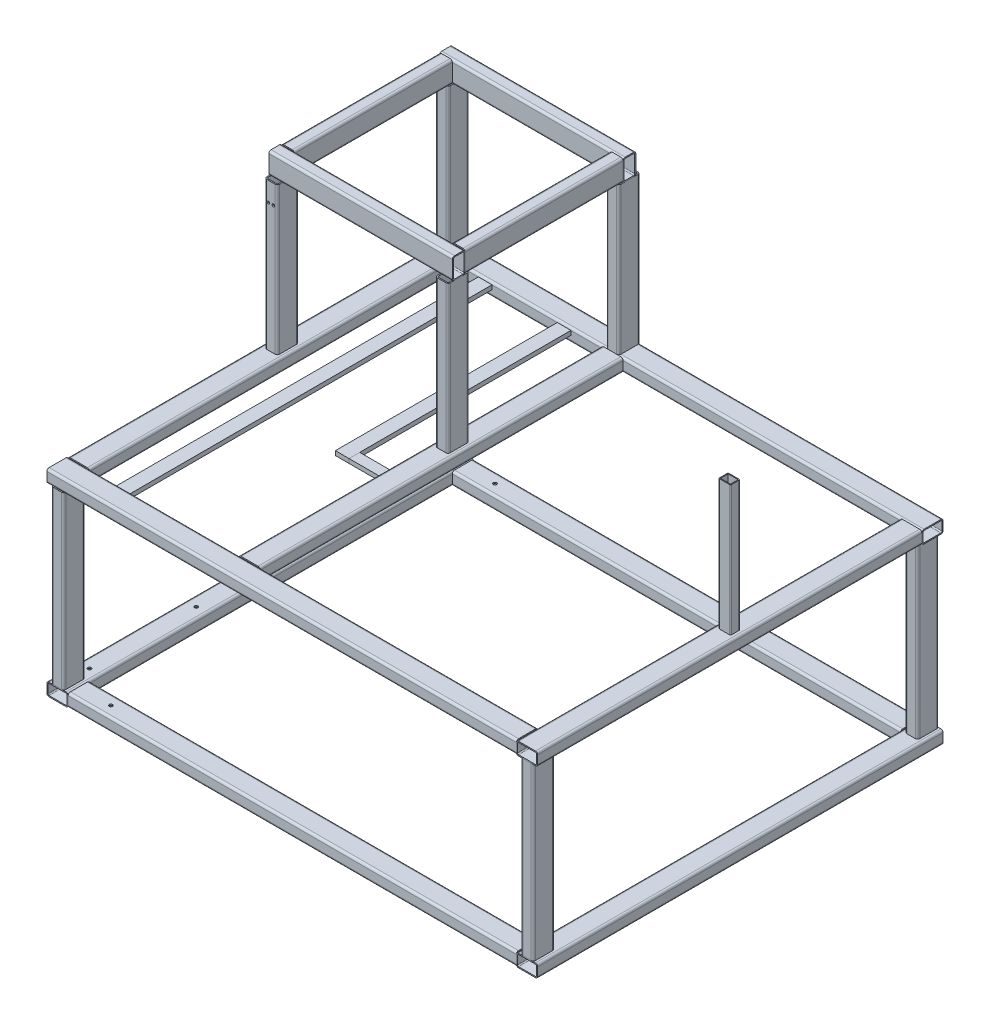
from build123d import *

# Parameters (mm, degrees)
RECTANGULAR_START                         = 15
RECTANGULAR_TUBE_50_X_30_X_2_6_1_DEPTH    = 400
RECTANGULAR_START_2                       = -925
RECTANGULAR_TUBE_50_X_30_X_2_6_1_2_DEPTH  = 950
RECTANGULAR_START_3                       = 25
RECTANGULAR_TUBE_50_X_30_X_2_6_1_3_DEPTH  = 1050
RECTANGULAR_TUBE_50_X_30_X_2_6_1_4_DEPTH  = 400
RECTANGULAR_TUBE_50_X_30_X_2_6_1_5_DEPTH  = 1050
RECTANGULAR_TUBE_50_X_30_X_2_6_1_6_DEPTH  = 400
RECTANGULAR_TUBE_50_X_30_X_2_6_1_7_DEPTH  = 950
RECTANGULAR_TUBE_50_X_30_X_2_6_1_8_DEPTH  = 400
RECTANGULAR_START_4                       = -875
RECTANGULAR_TUBE_50_X_30_X_2_6_1_9_DEPTH  = 900
RECTANGULAR_TUBE_50_X_30_X_2_6_1_10_DEPTH = 1100
RECTANGULAR_START_5                       = -25
RECTANGULAR_TUBE_50_X_30_X_2_6_1_11_DEPTH = 1100
RECTANGULAR_TUBE_50_X_30_X_2_6_1_12_DEPTH = 900
RECTANGULAR_TUBE_50_X_30_X_2_6_1_13_DEPTH = 850
SKETCH3_R                                 = 4
CUT_EXTRUDE2_DEPTH                        = 64
SKETCH4_R                                 = 4
CUT_EXTRUDE3_DEPTH                        = 64
RECTANGULAR_START_6                       = 445
RECTANGULAR_TUBE_50_X_30_X_2_6_24_DEPTH   = 345
RECTANGULAR_START_7                       = -15
RECTANGULAR_TUBE_50_X_30_X_2_6_24_2_DEPTH = 430
RECTANGULAR_START_8                       = -885
RECTANGULAR_TUBE_50_X_30_X_2_6_24_3_DEPTH = 370
RECTANGULAR_TUBE_50_X_30_X_2_6_24_4_DEPTH = 345
RECTANGULAR_TUBE_50_X_30_X_2_6_24_5_DEPTH = 370
RECTANGULAR_TUBE_50_X_30_X_2_6_24_6_DEPTH = 345
RECTANGULAR_TUBE_50_X_30_X_2_6_24_7_DEPTH = 430
RECTANGULAR_TUBE_50_X_30_X_2_6_24_8_DEPTH = 345
SKETCH16_W                                = 32
SKETCH16_H                                = 10
BOSS_EXTRUDE2_DEPTH                       = 850
SKETCH17_W                                = 32
SKETCH17_H                                = 10
BOSS_EXTRUDE3_DEPTH                       = 520
SKETCH18_W                                = 25
SKETCH18_H                                = 10
BOSS_EXTRUDE4_DEPTH                       = 72
SKETCH20_R                                = 3
CUT_EXTRUDE4_DEPTH                        = 10
SKETCH21_W                                = 27.6
SKETCH21_H                                = 22
SKETCH21_W_2                              = 23.6
SKETCH21_H_2                              = 18
BOSS_EXTRUDE5_DEPTH                       = 305
FILLET1_R                                 = 2


with BuildPart() as part:
    # Rectangular tube 50 X 30 X 2.6(1): read off the stored shape, not the designer's step
    # Rectangular tube 50 X 30 X 2.6(1) outline → Rectangular tube 50 X 30 X 2.6(1) (new body)
    with BuildSketch(Plane(origin=(0, 0, 0), x_dir=(1, 0, 0), z_dir=(0, 1, 0)).offset(RECTANGULAR_START)):
        with BuildLine():
            Line((1115, 880.2), (1115, 919.8))
            ThreePointArc((1115, 919.8), (1113.476955262, 923.476955262), (1109.8, 925))
            Line((1109.8, 925), (1090.2, 925))
            ThreePointArc((1090.2, 925), (1086.523044738, 923.476955262), (1085, 919.8))
            Line((1085, 919.8), (1085, 880.2))
            ThreePointArc((1085, 880.2), (1086.523044738, 876.523044738), (1090.2, 875))
            Line((1090.2, 875), (1109.8, 875))
            ThreePointArc((1109.8, 875), (1113.476955262, 876.523044738), (1115, 880.2))
        make_face()
        with BuildLine():
            ThreePointArc((1090.2, 877.6), (1088.361522369, 878.361522369), (1087.6, 880.2))
            Line((1087.6, 880.2), (1087.6, 919.8))
            ThreePointArc((1087.6, 919.8), (1088.361522369, 921.638477631), (1090.2, 922.4))
            Line((1090.2, 922.4), (1109.8, 922.4))
            ThreePointArc((1109.8, 922.4), (1111.638477631, 921.638477631), (1112.4, 919.8))
            Line((1112.4, 919.8), (1112.4, 880.2))
            ThreePointArc((1112.4, 880.2), (1111.638477631, 878.361522369), (1109.8, 877.6))
            Line((1109.8, 877.6), (1090.2, 877.6))
        make_face(mode=Mode.SUBTRACT)
    extrude(amount=RECTANGULAR_TUBE_50_X_30_X_2_6_1_DEPTH)


with BuildPart() as body_2:
    # Rectangular tube 50 X 30 X 2.6_1 2 outli → Rectangular tube 50 X 30 X 2.6_1 2 (new body)
    with BuildSketch(Plane.XY.offset(RECTANGULAR_START_2)):
        with BuildLine():
            ThreePointArc((1080.2, 15), (1076.523044738, 13.476955262), (1075, 9.8))
            Line((1075, 9.8), (1075, -9.8))
            ThreePointArc((1075, -9.8), (1076.523044738, -13.476955262), (1080.2, -15))
            Line((1080.2, -15), (1119.8, -15))
            ThreePointArc((1119.8, -15), (1123.476955262, -13.476955262), (1125, -9.8))
            Line((1125, -9.8), (1125, 9.8))
            ThreePointArc((1125, 9.8), (1123.476955262, 13.476955262), (1119.8, 15))
            Line((1119.8, 15), (1080.2, 15))
        make_face()
        with BuildLine():
            Line((1119.8, -12.4), (1080.2, -12.4))
            ThreePointArc((1080.2, -12.4), (1078.361522369, -11.638477631), (1077.6, -9.8))
            Line((1077.6, -9.8), (1077.6, 9.8))
            ThreePointArc((1077.6, 9.8), (1078.361522369, 11.638477631), (1080.2, 12.4))
            Line((1080.2, 12.4), (1119.8, 12.4))
            ThreePointArc((1119.8, 12.4), (1121.638477631, 11.638477631), (1122.4, 9.8))
            Line((1122.4, 9.8), (1122.4, -9.8))
            ThreePointArc((1122.4, -9.8), (1121.638477631, -11.638477631), (1119.8, -12.4))
        make_face(mode=Mode.SUBTRACT)
    extrude(amount=RECTANGULAR_TUBE_50_X_30_X_2_6_1_2_DEPTH)


with BuildPart() as body_3:
    # Rectangular tube 50 X 30 X 2.6_1 3 outli → Rectangular tube 50 X 30 X 2.6_1 3 (new body)
    with BuildSketch(Plane.YZ.offset(RECTANGULAR_START_3)):
        with BuildLine():
            ThreePointArc((15, -880.2), (13.476955262, -876.523044738), (9.8, -875))
            Line((9.8, -875), (-9.8, -875))
            ThreePointArc((-9.8, -875), (-13.476955262, -876.523044738), (-15, -880.2))
            Line((-15, -880.2), (-15, -919.8))
            ThreePointArc((-15, -919.8), (-13.476955262, -923.476955262), (-9.8, -925))
            Line((-9.8, -925), (9.8, -925))
            ThreePointArc((9.8, -925), (13.476955262, -923.476955262), (15, -919.8))
            Line((15, -919.8), (15, -880.2))
        make_face()
        with BuildLine():
            Line((-12.4, -919.8), (-12.4, -880.2))
            ThreePointArc((-12.4, -880.2), (-11.638477631, -878.361522369), (-9.8, -877.6))
            Line((-9.8, -877.6), (9.8, -877.6))
            ThreePointArc((9.8, -877.6), (11.638477631, -878.361522369), (12.4, -880.2))
            Line((12.4, -880.2), (12.4, -919.8))
            ThreePointArc((12.4, -919.8), (11.638477631, -921.638477631), (9.8, -922.4))
            Line((9.8, -922.4), (-9.8, -922.4))
            ThreePointArc((-9.8, -922.4), (-11.638477631, -921.638477631), (-12.4, -919.8))
        make_face(mode=Mode.SUBTRACT)
    extrude(amount=RECTANGULAR_TUBE_50_X_30_X_2_6_1_3_DEPTH)


with BuildPart() as body_4:
    # Rectangular tube 50 X 30 X 2.6_1 4 outli → Rectangular tube 50 X 30 X 2.6_1 4 (new body)
    with BuildSketch(Plane(origin=(0, 0, 0), x_dir=(1, 0, 0), z_dir=(0, 1, 0)).offset(RECTANGULAR_START)):
        with BuildLine():
            Line((1115, -19.8), (1115, 19.8))
            ThreePointArc((1115, 19.8), (1113.476955262, 23.476955262), (1109.8, 25))
            Line((1109.8, 25), (1090.2, 25))
            ThreePointArc((1090.2, 25), (1086.523044738, 23.476955262), (1085, 19.8))
            Line((1085, 19.8), (1085, -19.8))
            ThreePointArc((1085, -19.8), (1086.523044738, -23.476955262), (1090.2, -25))
            Line((1090.2, -25), (1109.8, -25))
            ThreePointArc((1109.8, -25), (1113.476955262, -23.476955262), (1115, -19.8))
        make_face()
        with BuildLine():
            ThreePointArc((1090.2, -22.4), (1088.361522369, -21.638477631), (1087.6, -19.8))
            Line((1087.6, -19.8), (1087.6, 19.8))
            ThreePointArc((1087.6, 19.8), (1088.361522369, 21.638477631), (1090.2, 22.4))
            Line((1090.2, 22.4), (1109.8, 22.4))
            ThreePointArc((1109.8, 22.4), (1111.638477631, 21.638477631), (1112.4, 19.8))
            Line((1112.4, 19.8), (1112.4, -19.8))
            ThreePointArc((1112.4, -19.8), (1111.638477631, -21.638477631), (1109.8, -22.4))
            Line((1109.8, -22.4), (1090.2, -22.4))
        make_face(mode=Mode.SUBTRACT)
    extrude(amount=RECTANGULAR_TUBE_50_X_30_X_2_6_1_4_DEPTH)


with BuildPart() as body_5:
    # Rectangular tube 50 X 30 X 2.6_1 5 outli → Rectangular tube 50 X 30 X 2.6_1 5 (new body)
    with BuildSketch(Plane.YZ.offset(RECTANGULAR_START_3)):
        with BuildLine():
            Line((-9.8, -25), (9.8, -25))
            ThreePointArc((9.8, -25), (13.476955262, -23.476955262), (15, -19.8))
            Line((15, -19.8), (15, 19.8))
            ThreePointArc((15, 19.8), (13.476955262, 23.476955262), (9.8, 25))
            Line((9.8, 25), (-9.8, 25))
            ThreePointArc((-9.8, 25), (-13.476955262, 23.476955262), (-15, 19.8))
            Line((-15, 19.8), (-15, -19.8))
            ThreePointArc((-15, -19.8), (-13.476955262, -23.476955262), (-9.8, -25))
        make_face()
        with BuildLine():
            ThreePointArc((-9.8, -22.4), (-11.638477631, -21.638477631), (-12.4, -19.8))
            Line((-12.4, -19.8), (-12.4, 19.8))
            ThreePointArc((-12.4, 19.8), (-11.638477631, 21.638477631), (-9.8, 22.4))
            Line((-9.8, 22.4), (9.8, 22.4))
            ThreePointArc((9.8, 22.4), (11.638477631, 21.638477631), (12.4, 19.8))
            Line((12.4, 19.8), (12.4, -19.8))
            ThreePointArc((12.4, -19.8), (11.638477631, -21.638477631), (9.8, -22.4))
            Line((9.8, -22.4), (-9.8, -22.4))
        make_face(mode=Mode.SUBTRACT)
    extrude(amount=RECTANGULAR_TUBE_50_X_30_X_2_6_1_5_DEPTH)


with BuildPart() as body_6:
    # Rectangular tube 50 X 30 X 2.6_1 6 outli → Rectangular tube 50 X 30 X 2.6_1 6 (new body)
    with BuildSketch(Plane(origin=(0, 0, 0), x_dir=(1, 0, 0), z_dir=(0, 1, 0)).offset(RECTANGULAR_START)):
        with BuildLine():
            Line((15, -19.8), (15, 19.8))
            ThreePointArc((15, 19.8), (13.476955262, 23.476955262), (9.8, 25))
            Line((9.8, 25), (-9.8, 25))
            ThreePointArc((-9.8, 25), (-13.476955262, 23.476955262), (-15, 19.8))
            Line((-15, 19.8), (-15, -19.8))
            ThreePointArc((-15, -19.8), (-13.476955262, -23.476955262), (-9.8, -25))
            Line((-9.8, -25), (9.8, -25))
            ThreePointArc((9.8, -25), (13.476955262, -23.476955262), (15, -19.8))
        make_face()
        with BuildLine():
            ThreePointArc((-9.8, -22.4), (-11.638477631, -21.638477631), (-12.4, -19.8))
            Line((-12.4, -19.8), (-12.4, 19.8))
            ThreePointArc((-12.4, 19.8), (-11.638477631, 21.638477631), (-9.8, 22.4))
            Line((-9.8, 22.4), (9.8, 22.4))
            ThreePointArc((9.8, 22.4), (11.638477631, 21.638477631), (12.4, 19.8))
            Line((12.4, 19.8), (12.4, -19.8))
            ThreePointArc((12.4, -19.8), (11.638477631, -21.638477631), (9.8, -22.4))
            Line((9.8, -22.4), (-9.8, -22.4))
        make_face(mode=Mode.SUBTRACT)
    extrude(amount=RECTANGULAR_TUBE_50_X_30_X_2_6_1_6_DEPTH)


with BuildPart() as body_7:
    # Rectangular tube 50 X 30 X 2.6_1 7 outli → Rectangular tube 50 X 30 X 2.6_1 7 (new body)
    with BuildSketch(Plane.XY.offset(RECTANGULAR_START_2)):
        with BuildLine():
            Line((25, -9.8), (25, 9.8))
            ThreePointArc((25, 9.8), (23.476955262, 13.476955262), (19.8, 15))
            Line((19.8, 15), (-19.8, 15))
            ThreePointArc((-19.8, 15), (-23.476955262, 13.476955262), (-25, 9.8))
            Line((-25, 9.8), (-25, -9.8))
            ThreePointArc((-25, -9.8), (-23.476955262, -13.476955262), (-19.8, -15))
            Line((-19.8, -15), (19.8, -15))
            ThreePointArc((19.8, -15), (23.476955262, -13.476955262), (25, -9.8))
        make_face()
        with BuildLine():
            ThreePointArc((22.4, -9.8), (21.638477631, -11.638477631), (19.8, -12.4))
            Line((19.8, -12.4), (-19.8, -12.4))
            ThreePointArc((-19.8, -12.4), (-21.638477631, -11.638477631), (-22.4, -9.8))
            Line((-22.4, -9.8), (-22.4, 9.8))
            ThreePointArc((-22.4, 9.8), (-21.638477631, 11.638477631), (-19.8, 12.4))
            Line((-19.8, 12.4), (19.8, 12.4))
            ThreePointArc((19.8, 12.4), (21.638477631, 11.638477631), (22.4, 9.8))
            Line((22.4, 9.8), (22.4, -9.8))
        make_face(mode=Mode.SUBTRACT)
    extrude(amount=RECTANGULAR_TUBE_50_X_30_X_2_6_1_7_DEPTH)

    # Sketch3 → Cut-Extrude2 (cut)
    with BuildSketch(Plane.XZ.offset(15)):
        with Locations((0, -50)):
            Circle(SKETCH3_R)
        with Locations((0, -850)):
            Circle(SKETCH3_R)
        with Locations((0, -300)):
            Circle(SKETCH3_R)
        with Locations((0, -600)):
            Circle(SKETCH3_R)
    extrude(amount=-CUT_EXTRUDE2_DEPTH, mode=Mode.SUBTRACT)


with BuildPart() as body_8:
    # Rectangular tube 50 X 30 X 2.6_1 8 outli → Rectangular tube 50 X 30 X 2.6_1 8 (new body)
    with BuildSketch(Plane(origin=(0, 0, 0), x_dir=(1, 0, 0), z_dir=(0, 1, 0)).offset(RECTANGULAR_START)):
        with BuildLine():
            Line((15, 880.2), (15, 919.8))
            ThreePointArc((15, 919.8), (13.476955262, 923.476955262), (9.8, 925))
            Line((9.8, 925), (-9.8, 925))
            ThreePointArc((-9.8, 925), (-13.476955262, 923.476955262), (-15, 919.8))
            Line((-15, 919.8), (-15, 880.2))
            ThreePointArc((-15, 880.2), (-13.476955262, 876.523044738), (-9.8, 875))
            Line((-9.8, 875), (9.8, 875))
            ThreePointArc((9.8, 875), (13.476955262, 876.523044738), (15, 880.2))
        make_face()
        with BuildLine():
            ThreePointArc((-9.8, 877.6), (-11.638477631, 878.361522369), (-12.4, 880.2))
            Line((-12.4, 880.2), (-12.4, 919.8))
            ThreePointArc((-12.4, 919.8), (-11.638477631, 921.638477631), (-9.8, 922.4))
            Line((-9.8, 922.4), (9.8, 922.4))
            ThreePointArc((9.8, 922.4), (11.638477631, 921.638477631), (12.4, 919.8))
            Line((12.4, 919.8), (12.4, 880.2))
            ThreePointArc((12.4, 880.2), (11.638477631, 878.361522369), (9.8, 877.6))
            Line((9.8, 877.6), (-9.8, 877.6))
        make_face(mode=Mode.SUBTRACT)
    extrude(amount=RECTANGULAR_TUBE_50_X_30_X_2_6_1_8_DEPTH)


with BuildPart() as body_9:
    # Rectangular tube 50 X 30 X 2.6_1 9 outli → Rectangular tube 50 X 30 X 2.6_1 9 (new body)
    with BuildSketch(Plane.XY.offset(RECTANGULAR_START_4)):
        with BuildLine():
            Line((1119.8, 445), (1080.2, 445))
            ThreePointArc((1080.2, 445), (1076.523044738, 443.476955262), (1075, 439.8))
            Line((1075, 439.8), (1075, 420.2))
            ThreePointArc((1075, 420.2), (1076.523044738, 416.523044738), (1080.2, 415))
            Line((1080.2, 415), (1119.8, 415))
            ThreePointArc((1119.8, 415), (1123.476955262, 416.523044738), (1125, 420.2))
            Line((1125, 420.2), (1125, 439.8))
            ThreePointArc((1125, 439.8), (1123.476955262, 443.476955262), (1119.8, 445))
        make_face()
        with BuildLine():
            ThreePointArc((1122.4, 420.2), (1121.638477631, 418.361522369), (1119.8, 417.6))
            Line((1119.8, 417.6), (1080.2, 417.6))
            ThreePointArc((1080.2, 417.6), (1078.361522369, 418.361522369), (1077.6, 420.2))
            Line((1077.6, 420.2), (1077.6, 439.8))
            ThreePointArc((1077.6, 439.8), (1078.361522369, 441.638477631), (1080.2, 442.4))
            Line((1080.2, 442.4), (1119.8, 442.4))
            ThreePointArc((1119.8, 442.4), (1121.638477631, 441.638477631), (1122.4, 439.8))
            Line((1122.4, 439.8), (1122.4, 420.2))
        make_face(mode=Mode.SUBTRACT)
    extrude(amount=RECTANGULAR_TUBE_50_X_30_X_2_6_1_9_DEPTH)


with BuildPart() as body_10:
    # Rectangular tube 50 X 30 X 2.6_1 10 outl → Rectangular tube 50 X 30 X 2.6_1 10 (new body)
    with BuildSketch(Plane.YZ.offset(RECTANGULAR_START_3)):
        with BuildLine():
            Line((445, -919.8), (445, -880.2))
            ThreePointArc((445, -880.2), (443.476955262, -876.523044738), (439.8, -875))
            Line((439.8, -875), (420.2, -875))
            ThreePointArc((420.2, -875), (416.523044738, -876.523044738), (415, -880.2))
            Line((415, -880.2), (415, -919.8))
            ThreePointArc((415, -919.8), (416.523044738, -923.476955262), (420.2, -925))
            Line((420.2, -925), (439.8, -925))
            ThreePointArc((439.8, -925), (443.476955262, -923.476955262), (445, -919.8))
        make_face()
        with BuildLine():
            ThreePointArc((420.2, -922.4), (418.361522369, -921.638477631), (417.6, -919.8))
            Line((417.6, -919.8), (417.6, -880.2))
            ThreePointArc((417.6, -880.2), (418.361522369, -878.361522369), (420.2, -877.6))
            Line((420.2, -877.6), (439.8, -877.6))
            ThreePointArc((439.8, -877.6), (441.638477631, -878.361522369), (442.4, -880.2))
            Line((442.4, -880.2), (442.4, -919.8))
            ThreePointArc((442.4, -919.8), (441.638477631, -921.638477631), (439.8, -922.4))
            Line((439.8, -922.4), (420.2, -922.4))
        make_face(mode=Mode.SUBTRACT)
    extrude(amount=RECTANGULAR_TUBE_50_X_30_X_2_6_1_10_DEPTH)


with BuildPart() as body_11:
    # Rectangular tube 50 X 30 X 2.6_1 11 outl → Rectangular tube 50 X 30 X 2.6_1 11 (new body)
    with BuildSketch(Plane.YZ.offset(RECTANGULAR_START_5)):
        with BuildLine():
            Line((445, -19.8), (445, 19.8))
            ThreePointArc((445, 19.8), (443.476955262, 23.476955262), (439.8, 25))
            Line((439.8, 25), (420.2, 25))
            ThreePointArc((420.2, 25), (416.523044738, 23.476955262), (415, 19.8))
            Line((415, 19.8), (415, -19.8))
            ThreePointArc((415, -19.8), (416.523044738, -23.476955262), (420.2, -25))
            Line((420.2, -25), (439.8, -25))
            ThreePointArc((439.8, -25), (443.476955262, -23.476955262), (445, -19.8))
        make_face()
        with BuildLine():
            ThreePointArc((420.2, -22.4), (418.361522369, -21.638477631), (417.6, -19.8))
            Line((417.6, -19.8), (417.6, 19.8))
            ThreePointArc((417.6, 19.8), (418.361522369, 21.638477631), (420.2, 22.4))
            Line((420.2, 22.4), (439.8, 22.4))
            ThreePointArc((439.8, 22.4), (441.638477631, 21.638477631), (442.4, 19.8))
            Line((442.4, 19.8), (442.4, -19.8))
            ThreePointArc((442.4, -19.8), (441.638477631, -21.638477631), (439.8, -22.4))
            Line((439.8, -22.4), (420.2, -22.4))
        make_face(mode=Mode.SUBTRACT)
    extrude(amount=RECTANGULAR_TUBE_50_X_30_X_2_6_1_11_DEPTH)


with BuildPart() as body_12:
    # Rectangular tube 50 X 30 X 2.6_1 12 outl → Rectangular tube 50 X 30 X 2.6_1 12 (new body)
    with BuildSketch(Plane.XY.offset(RECTANGULAR_START_2)):
        with BuildLine():
            Line((19.8, 445), (-19.8, 445))
            ThreePointArc((-19.8, 445), (-23.476955262, 443.476955262), (-25, 439.8))
            Line((-25, 439.8), (-25, 420.2))
            ThreePointArc((-25, 420.2), (-23.476955262, 416.523044738), (-19.8, 415))
            Line((-19.8, 415), (19.8, 415))
            ThreePointArc((19.8, 415), (23.476955262, 416.523044738), (25, 420.2))
            Line((25, 420.2), (25, 439.8))
            ThreePointArc((25, 439.8), (23.476955262, 443.476955262), (19.8, 445))
        make_face()
        with BuildLine():
            ThreePointArc((22.4, 420.2), (21.638477631, 418.361522369), (19.8, 417.6))
            Line((19.8, 417.6), (-19.8, 417.6))
            ThreePointArc((-19.8, 417.6), (-21.638477631, 418.361522369), (-22.4, 420.2))
            Line((-22.4, 420.2), (-22.4, 439.8))
            ThreePointArc((-22.4, 439.8), (-21.638477631, 441.638477631), (-19.8, 442.4))
            Line((-19.8, 442.4), (19.8, 442.4))
            ThreePointArc((19.8, 442.4), (21.638477631, 441.638477631), (22.4, 439.8))
            Line((22.4, 439.8), (22.4, 420.2))
        make_face(mode=Mode.SUBTRACT)
    extrude(amount=RECTANGULAR_TUBE_50_X_30_X_2_6_1_12_DEPTH)


with BuildPart() as body_13:
    # Rectangular tube 50 X 30 X 2.6_1 13 outl → Rectangular tube 50 X 30 X 2.6_1 13 (new body)
    with BuildSketch(Plane.XY.offset(RECTANGULAR_START_4)):
        with BuildLine():
            Line((375, 439.8), (375, 420.2))
            ThreePointArc((375, 420.2), (376.523044738, 416.523044738), (380.2, 415))
            Line((380.2, 415), (419.8, 415))
            ThreePointArc((419.8, 415), (423.476955262, 416.523044738), (425, 420.2))
            Line((425, 420.2), (425, 439.8))
            ThreePointArc((425, 439.8), (423.476955262, 443.476955262), (419.8, 445))
            Line((419.8, 445), (380.2, 445))
            ThreePointArc((380.2, 445), (376.523044738, 443.476955262), (375, 439.8))
        make_face()
        with BuildLine():
            ThreePointArc((377.6, 439.8), (378.361522369, 441.638477631), (380.2, 442.4))
            Line((380.2, 442.4), (419.8, 442.4))
            ThreePointArc((419.8, 442.4), (421.638477631, 441.638477631), (422.4, 439.8))
            Line((422.4, 439.8), (422.4, 420.2))
            ThreePointArc((422.4, 420.2), (421.638477631, 418.361522369), (419.8, 417.6))
            Line((419.8, 417.6), (380.2, 417.6))
            ThreePointArc((380.2, 417.6), (378.361522369, 418.361522369), (377.6, 420.2))
            Line((377.6, 420.2), (377.6, 439.8))
        make_face(mode=Mode.SUBTRACT)
    extrude(amount=RECTANGULAR_TUBE_50_X_30_X_2_6_1_13_DEPTH)


with BuildPart() as cut_extrude3_tool:
    # Sketch4 → Cut-Extrude3 (new body)
    with BuildSketch(Plane.XZ.offset(15)):
        with Locations(Location((100, 0, 0), (0, 0, 270))):
            Circle(SKETCH4_R)
        with Locations(Location((100, -900, 0), (0, 0, 270))):
            Circle(SKETCH4_R)
    extrude(amount=-CUT_EXTRUDE3_DEPTH)


with BuildPart() as body_3_1:
    add(body_3.part)

    # Cut-Extrude3: cut by cut_extrude3_tool
    add(cut_extrude3_tool.part, mode=Mode.SUBTRACT)


with BuildPart() as body_5_1:
    add(body_5.part)

    # Cut-Extrude3: cut by cut_extrude3_tool
    add(cut_extrude3_tool.part, mode=Mode.SUBTRACT)


with BuildPart() as body_14:
    # Rectangular tube 50 X 30 X 2.6(24): read off the stored shape, not the designer's step
    # Rectangular tube 50 X 30 X 2.6(24) outlin → Rectangular tube 50 X 30 X 2.6(24) (new body)
    with BuildSketch(Plane(origin=(0, 0, 0), x_dir=(1, 0, 0), z_dir=(0, 1, 0)).offset(RECTANGULAR_START_6)):
        with BuildLine():
            ThreePointArc((-9.8, 525), (-13.476955262, 523.476955262), (-15, 519.8))
            Line((-15, 519.8), (-15, 480.2))
            ThreePointArc((-15, 480.2), (-13.476955262, 476.523044738), (-9.8, 475))
            Line((-9.8, 475), (9.8, 475))
            ThreePointArc((9.8, 475), (13.476955262, 476.523044738), (15, 480.2))
            Line((15, 480.2), (15, 519.8))
            ThreePointArc((15, 519.8), (13.476955262, 523.476955262), (9.8, 525))
            Line((9.8, 525), (-9.8, 525))
        make_face()
        with BuildLine():
            Line((-9.8, 522.4), (9.8, 522.4))
            ThreePointArc((9.8, 522.4), (11.638477631, 521.638477631), (12.4, 519.8))
            Line((12.4, 519.8), (12.4, 480.2))
            ThreePointArc((12.4, 480.2), (11.638477631, 478.361522369), (9.8, 477.6))
            Line((9.8, 477.6), (-9.8, 477.6))
            ThreePointArc((-9.8, 477.6), (-11.638477631, 478.361522369), (-12.4, 480.2))
            Line((-12.4, 480.2), (-12.4, 519.8))
            ThreePointArc((-12.4, 519.8), (-11.638477631, 521.638477631), (-9.8, 522.4))
        make_face(mode=Mode.SUBTRACT)
    extrude(amount=RECTANGULAR_TUBE_50_X_30_X_2_6_24_DEPTH)

    # Sketch20 → Cut-Extrude4 (cut)
    with BuildSketch(Plane.XY.offset(-475)):
        with Locations((-5.75, 745)):
            Circle(SKETCH20_R)
        with Locations((5.75, 745)):
            Circle(SKETCH20_R)
    extrude(amount=-CUT_EXTRUDE4_DEPTH, mode=Mode.SUBTRACT)


with BuildPart() as body_15:
    # Rectangular tube 50 X 30 X 2.6_24 2 outl → Rectangular tube 50 X 30 X 2.6_24 2 (new body)
    with BuildSketch(Plane.YZ.offset(RECTANGULAR_START_7)):
        with BuildLine():
            ThreePointArc((834.8, -515), (838.476955262, -513.476955262), (840, -509.8))
            Line((840, -509.8), (840, -490.2))
            ThreePointArc((840, -490.2), (838.476955262, -486.523044738), (834.8, -485))
            Line((834.8, -485), (795.2, -485))
            ThreePointArc((795.2, -485), (791.523044738, -486.523044738), (790, -490.2))
            Line((790, -490.2), (790, -509.8))
            ThreePointArc((790, -509.8), (791.523044738, -513.476955262), (795.2, -515))
            Line((795.2, -515), (834.8, -515))
        make_face()
        with BuildLine():
            Line((795.2, -487.6), (834.8, -487.6))
            ThreePointArc((834.8, -487.6), (836.638477631, -488.361522369), (837.4, -490.2))
            Line((837.4, -490.2), (837.4, -509.8))
            ThreePointArc((837.4, -509.8), (836.638477631, -511.638477631), (834.8, -512.4))
            Line((834.8, -512.4), (795.2, -512.4))
            ThreePointArc((795.2, -512.4), (793.361522369, -511.638477631), (792.6, -509.8))
            Line((792.6, -509.8), (792.6, -490.2))
            ThreePointArc((792.6, -490.2), (793.361522369, -488.361522369), (795.2, -487.6))
        make_face(mode=Mode.SUBTRACT)
    extrude(amount=RECTANGULAR_TUBE_50_X_30_X_2_6_24_2_DEPTH)


with BuildPart() as body_16:
    # Rectangular tube 50 X 30 X 2.6_24 3 outl → Rectangular tube 50 X 30 X 2.6_24 3 (new body)
    with BuildSketch(Plane.XY.offset(RECTANGULAR_START_8)):
        with BuildLine():
            ThreePointArc((15, 834.8), (13.476955262, 838.476955262), (9.8, 840))
            Line((9.8, 840), (-9.8, 840))
            ThreePointArc((-9.8, 840), (-13.476955262, 838.476955262), (-15, 834.8))
            Line((-15, 834.8), (-15, 795.2))
            ThreePointArc((-15, 795.2), (-13.476955262, 791.523044738), (-9.8, 790))
            Line((-9.8, 790), (9.8, 790))
            ThreePointArc((9.8, 790), (13.476955262, 791.523044738), (15, 795.2))
            Line((15, 795.2), (15, 834.8))
        make_face()
        with BuildLine():
            Line((-12.4, 795.2), (-12.4, 834.8))
            ThreePointArc((-12.4, 834.8), (-11.638477631, 836.638477631), (-9.8, 837.4))
            Line((-9.8, 837.4), (9.8, 837.4))
            ThreePointArc((9.8, 837.4), (11.638477631, 836.638477631), (12.4, 834.8))
            Line((12.4, 834.8), (12.4, 795.2))
            ThreePointArc((12.4, 795.2), (11.638477631, 793.361522369), (9.8, 792.6))
            Line((9.8, 792.6), (-9.8, 792.6))
            ThreePointArc((-9.8, 792.6), (-11.638477631, 793.361522369), (-12.4, 795.2))
        make_face(mode=Mode.SUBTRACT)
    extrude(amount=RECTANGULAR_TUBE_50_X_30_X_2_6_24_3_DEPTH)


with BuildPart() as body_17:
    # Rectangular tube 50 X 30 X 2.6_24 4 outl → Rectangular tube 50 X 30 X 2.6_24 4 (new body)
    with BuildSketch(Plane(origin=(0, 0, 0), x_dir=(1, 0, 0), z_dir=(0, 1, 0)).offset(RECTANGULAR_START_6)):
        with BuildLine():
            ThreePointArc((390.2, 525), (386.523044738, 523.476955262), (385, 519.8))
            Line((385, 519.8), (385, 480.2))
            ThreePointArc((385, 480.2), (386.523044738, 476.523044738), (390.2, 475))
            Line((390.2, 475), (409.8, 475))
            ThreePointArc((409.8, 475), (413.476955262, 476.523044738), (415, 480.2))
            Line((415, 480.2), (415, 519.8))
            ThreePointArc((415, 519.8), (413.476955262, 523.476955262), (409.8, 525))
            Line((409.8, 525), (390.2, 525))
        make_face()
        with BuildLine():
            Line((390.2, 522.4), (409.8, 522.4))
            ThreePointArc((409.8, 522.4), (411.638477631, 521.638477631), (412.4, 519.8))
            Line((412.4, 519.8), (412.4, 480.2))
            ThreePointArc((412.4, 480.2), (411.638477631, 478.361522369), (409.8, 477.6))
            Line((409.8, 477.6), (390.2, 477.6))
            ThreePointArc((390.2, 477.6), (388.361522369, 478.361522369), (387.6, 480.2))
            Line((387.6, 480.2), (387.6, 519.8))
            ThreePointArc((387.6, 519.8), (388.361522369, 521.638477631), (390.2, 522.4))
        make_face(mode=Mode.SUBTRACT)
    extrude(amount=RECTANGULAR_TUBE_50_X_30_X_2_6_24_4_DEPTH)


with BuildPart() as body_18:
    # Rectangular tube 50 X 30 X 2.6_24 5 outl → Rectangular tube 50 X 30 X 2.6_24 5 (new body)
    with BuildSketch(Plane.XY.offset(RECTANGULAR_START_8)):
        with BuildLine():
            Line((409.8, 840), (390.2, 840))
            ThreePointArc((390.2, 840), (386.523044738, 838.476955262), (385, 834.8))
            Line((385, 834.8), (385, 795.2))
            ThreePointArc((385, 795.2), (386.523044738, 791.523044738), (390.2, 790))
            Line((390.2, 790), (409.8, 790))
            ThreePointArc((409.8, 790), (413.476955262, 791.523044738), (415, 795.2))
            Line((415, 795.2), (415, 834.8))
            ThreePointArc((415, 834.8), (413.476955262, 838.476955262), (409.8, 840))
        make_face()
        with BuildLine():
            ThreePointArc((409.8, 837.4), (411.638477631, 836.638477631), (412.4, 834.8))
            Line((412.4, 834.8), (412.4, 795.2))
            ThreePointArc((412.4, 795.2), (411.638477631, 793.361522369), (409.8, 792.6))
            Line((409.8, 792.6), (390.2, 792.6))
            ThreePointArc((390.2, 792.6), (388.361522369, 793.361522369), (387.6, 795.2))
            Line((387.6, 795.2), (387.6, 834.8))
            ThreePointArc((387.6, 834.8), (388.361522369, 836.638477631), (390.2, 837.4))
            Line((390.2, 837.4), (409.8, 837.4))
        make_face(mode=Mode.SUBTRACT)
    extrude(amount=RECTANGULAR_TUBE_50_X_30_X_2_6_24_5_DEPTH)


with BuildPart() as body_19:
    # Rectangular tube 50 X 30 X 2.6_24 6 outl → Rectangular tube 50 X 30 X 2.6_24 6 (new body)
    with BuildSketch(Plane(origin=(0, 0, 0), x_dir=(1, 0, 0), z_dir=(0, 1, 0)).offset(RECTANGULAR_START_6)):
        with BuildLine():
            ThreePointArc((409.8, 875), (413.476955262, 876.523044738), (415, 880.2))
            Line((415, 880.2), (415, 919.8))
            ThreePointArc((415, 919.8), (413.476955262, 923.476955262), (409.8, 925))
            Line((409.8, 925), (390.2, 925))
            ThreePointArc((390.2, 925), (386.523044738, 923.476955262), (385, 919.8))
            Line((385, 919.8), (385, 880.2))
            ThreePointArc((385, 880.2), (386.523044738, 876.523044738), (390.2, 875))
            Line((390.2, 875), (409.8, 875))
        make_face()
        with BuildLine():
            Line((409.8, 877.6), (390.2, 877.6))
            ThreePointArc((390.2, 877.6), (388.361522369, 878.361522369), (387.6, 880.2))
            Line((387.6, 880.2), (387.6, 919.8))
            ThreePointArc((387.6, 919.8), (388.361522369, 921.638477631), (390.2, 922.4))
            Line((390.2, 922.4), (409.8, 922.4))
            ThreePointArc((409.8, 922.4), (411.638477631, 921.638477631), (412.4, 919.8))
            Line((412.4, 919.8), (412.4, 880.2))
            ThreePointArc((412.4, 880.2), (411.638477631, 878.361522369), (409.8, 877.6))
        make_face(mode=Mode.SUBTRACT)
    extrude(amount=RECTANGULAR_TUBE_50_X_30_X_2_6_24_6_DEPTH)


with BuildPart() as body_20:
    # Rectangular tube 50 X 30 X 2.6_24 7 outl → Rectangular tube 50 X 30 X 2.6_24 7 (new body)
    with BuildSketch(Plane.YZ.offset(RECTANGULAR_START_7)):
        with BuildLine():
            Line((840, -909.8), (840, -890.2))
            ThreePointArc((840, -890.2), (838.476955262, -886.523044738), (834.8, -885))
            Line((834.8, -885), (795.2, -885))
            ThreePointArc((795.2, -885), (791.523044738, -886.523044738), (790, -890.2))
            Line((790, -890.2), (790, -909.8))
            ThreePointArc((790, -909.8), (791.523044738, -913.476955262), (795.2, -915))
            Line((795.2, -915), (834.8, -915))
            ThreePointArc((834.8, -915), (838.476955262, -913.476955262), (840, -909.8))
        make_face()
        with BuildLine():
            ThreePointArc((837.4, -909.8), (836.638477631, -911.638477631), (834.8, -912.4))
            Line((834.8, -912.4), (795.2, -912.4))
            ThreePointArc((795.2, -912.4), (793.361522369, -911.638477631), (792.6, -909.8))
            Line((792.6, -909.8), (792.6, -890.2))
            ThreePointArc((792.6, -890.2), (793.361522369, -888.361522369), (795.2, -887.6))
            Line((795.2, -887.6), (834.8, -887.6))
            ThreePointArc((834.8, -887.6), (836.638477631, -888.361522369), (837.4, -890.2))
            Line((837.4, -890.2), (837.4, -909.8))
        make_face(mode=Mode.SUBTRACT)
    extrude(amount=RECTANGULAR_TUBE_50_X_30_X_2_6_24_7_DEPTH)


with BuildPart() as body_21:
    # Rectangular tube 50 X 30 X 2.6_24 8 outl → Rectangular tube 50 X 30 X 2.6_24 8 (new body)
    with BuildSketch(Plane(origin=(0, 0, 0), x_dir=(1, 0, 0), z_dir=(0, 1, 0)).offset(RECTANGULAR_START_6)):
        with BuildLine():
            ThreePointArc((9.8, 875), (13.476955262, 876.523044738), (15, 880.2))
            Line((15, 880.2), (15, 919.8))
            ThreePointArc((15, 919.8), (13.476955262, 923.476955262), (9.8, 925))
            Line((9.8, 925), (-9.8, 925))
            ThreePointArc((-9.8, 925), (-13.476955262, 923.476955262), (-15, 919.8))
            Line((-15, 919.8), (-15, 880.2))
            ThreePointArc((-15, 880.2), (-13.476955262, 876.523044738), (-9.8, 875))
            Line((-9.8, 875), (9.8, 875))
        make_face()
        with BuildLine():
            Line((9.8, 877.6), (-9.8, 877.6))
            ThreePointArc((-9.8, 877.6), (-11.638477631, 878.361522369), (-12.4, 880.2))
            Line((-12.4, 880.2), (-12.4, 919.8))
            ThreePointArc((-12.4, 919.8), (-11.638477631, 921.638477631), (-9.8, 922.4))
            Line((-9.8, 922.4), (9.8, 922.4))
            ThreePointArc((9.8, 922.4), (11.638477631, 921.638477631), (12.4, 919.8))
            Line((12.4, 919.8), (12.4, 880.2))
            ThreePointArc((12.4, 880.2), (11.638477631, 878.361522369), (9.8, 877.6))
        make_face(mode=Mode.SUBTRACT)
    extrude(amount=RECTANGULAR_TUBE_50_X_30_X_2_6_24_8_DEPTH)


with BuildPart() as body_22:
    # Sketch16 → Boss-Extrude2 (new body)
    with BuildSketch(Plane.XY.offset(-875)):
        with Locations((102, 435)):
            Rectangle(SKETCH16_W, SKETCH16_H)
    extrude(amount=BOSS_EXTRUDE2_DEPTH)


with BuildPart() as body_23:
    # Sketch17 → Boss-Extrude3 (new body)
    with BuildSketch(Plane.XY.offset(-875)):
        with Locations((287, 435)):
            Rectangle(SKETCH17_W, SKETCH17_H)
    extrude(amount=BOSS_EXTRUDE3_DEPTH)


with BuildPart() as body_24:
    # Sketch18 → Boss-Extrude4 (new body)
    with BuildSketch(Plane(origin=(303, 0, 0), x_dir=(0, 0, -1), z_dir=(1, 0, 0))):
        with Locations((367.5, 435)):
            Rectangle(SKETCH18_W, SKETCH18_H)
    extrude(amount=BOSS_EXTRUDE4_DEPTH)


with BuildPart() as body_25:
    # Sketch21 → Boss-Extrude5 (new body)
    with BuildSketch(Plane(origin=(0, 445, 0), x_dir=(1, 0, 0), z_dir=(0, 1, 0))):
        with Locations((1100, 449)):
            Rectangle(SKETCH21_W, SKETCH21_H)
        with Locations((1100, 449)):
            Rectangle(SKETCH21_W_2, SKETCH21_H_2, mode=Mode.SUBTRACT)
    extrude(amount=BOSS_EXTRUDE5_DEPTH)

    # Fillet1
    fillet1_edges = [body_25.edges().sort_by_distance(p)[0] for p in [
        (1086.2, 597.5, -460),
        (1113.8, 597.5, -460),
        (1113.8, 597.5, -438),
        (1086.2, 597.5, -438),
    ]]
    fillet(fillet1_edges, radius=FILLET1_R)


solid = Compound([part.part, body_2.part, body_4.part, body_6.part, body_7.part, body_8.part, body_9.part, body_10.part, body_11.part, body_12.part, body_13.part, body_3_1.part, body_5_1.part, body_14.part, body_15.part, body_16.part, body_17.part, body_18.part, body_19.part, body_20.part, body_21.part, body_22.part, body_23.part, body_24.part, body_25.part])
